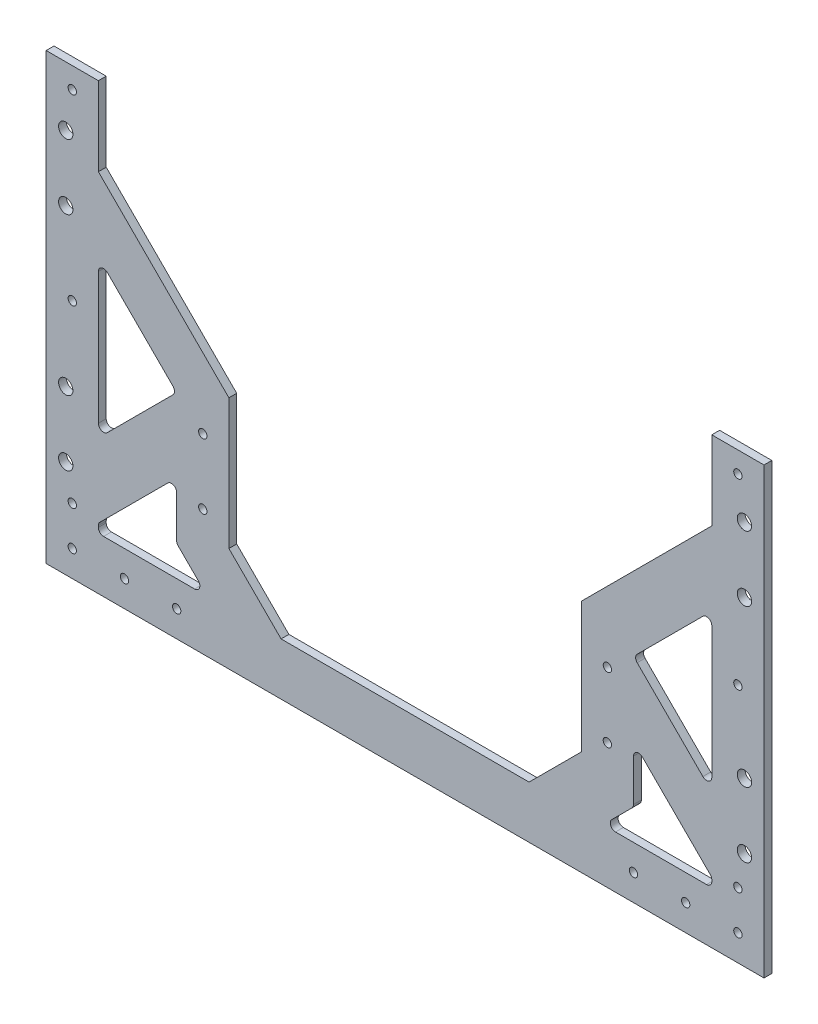
from build123d import *

# Parameters (mm, degrees)
EXTRUDE1_DEPTH     = 3
SKETCH2_R          = 2.75
SKETCH2_R_2        = 1.6
CUT_EXTRUDE1_DEPTH = 3


with BuildPart() as part:
    # Sketch1 → Extrude1 (new body)
    with BuildSketch(Plane.XY):
        Polygon((-21.510078765, 142.709593142), (-21.510078765, -27.502951786), (253.489921235, -27.502951786), (253.489921235, 142.709593142), (233.489921235, 142.709593142), (233.489921235, 112.497048214), (183.489921235, 62.497048214), (183.489921235, 12.497048214), (163.489921235, -7.502951786), (68.489921235, -7.502951786), (48.489921235, 12.497048214), (48.489921235, 62.497048214), (-1.510078765, 112.497048214), (-1.510078765, 142.709593142), align=None)
        with BuildLine():
            Line((-1.510078765, -5.502951786), (-1.510078765, -4.899921406))
            ThreePointArc((-1.510078765, -4.899921406), (-1.35783783, -4.134554541), (-0.924292327, -3.485707844))
            Line((-0.924292327, -3.485707844), (25.075707673, 22.514292156))
            ThreePointArc((25.075707673, 22.514292156), (27.2552881, 22.947837659), (28.489921235, 21.100078594))
            Line((28.489921235, 21.100078594), (28.489921235, 5.041204091))
            ThreePointArc((28.489921235, 5.041204091), (28.64216217, 4.275837226), (29.075707673, 3.626990528))
            Line((29.075707673, 3.626990528), (36.791436425, -4.088738224))
            ThreePointArc((36.791436425, -4.088738224), (37.224981928, -6.268318651), (35.377222863, -7.502951786))
            Line((35.377222863, -7.502951786), (0.489921235, -7.502951786))
            ThreePointArc((0.489921235, -7.502951786), (-0.924292327, -6.917165349), (-1.510078765, -5.502951786))
        make_face(mode=Mode.SUBTRACT)
        with BuildLine():
            Line((1.904134797, 80.798563404), (27.075707673, 55.626990528))
            ThreePointArc((27.075707673, 55.626990528), (27.66149411, 54.212776966), (27.075707673, 52.798563404))
            Line((27.075707673, 52.798563404), (1.904134797, 27.626990528))
            ThreePointArc((1.904134797, 27.626990528), (-0.27544563, 27.193445026), (-1.510078765, 29.041204091))
            Line((-1.510078765, 29.041204091), (-1.510078765, 79.384349841))
            ThreePointArc((-1.510078765, 79.384349841), (-0.27544563, 81.232108906), (1.904134797, 80.798563404))
        make_face(mode=Mode.SUBTRACT)
        with BuildLine():
            Line((233.489921235, 29.041204091), (233.489921235, 79.384349841))
            ThreePointArc((233.489921235, 79.384349841), (232.2552881, 81.232108906), (230.075707673, 80.798563404))
            Line((230.075707673, 80.798563404), (204.904134797, 55.626990528))
            ThreePointArc((204.904134797, 55.626990528), (204.31834836, 54.212776966), (204.904134797, 52.798563404))
            Line((204.904134797, 52.798563404), (230.075707673, 27.626990528))
            ThreePointArc((230.075707673, 27.626990528), (232.2552881, 27.193445026), (233.489921235, 29.041204091))
        make_face(mode=Mode.SUBTRACT)
        with BuildLine():
            Line((232.904134797, -3.485707844), (206.904134797, 22.514292156))
            ThreePointArc((206.904134797, 22.514292156), (204.72455437, 22.947837659), (203.489921235, 21.100078594))
            Line((203.489921235, 21.100078594), (203.489921235, 5.041204091))
            ThreePointArc((203.489921235, 5.041204091), (203.3376803, 4.275837226), (202.904134797, 3.626990528))
            Line((202.904134797, 3.626990528), (195.188406045, -4.088738224))
            ThreePointArc((195.188406045, -4.088738224), (194.754860542, -6.268318651), (196.602619607, -7.502951786))
            Line((196.602619607, -7.502951786), (231.489921235, -7.502951786))
            ThreePointArc((231.489921235, -7.502951786), (232.904134797, -6.917165349), (233.489921235, -5.502951786))
            Line((233.489921235, -5.502951786), (233.489921235, -4.899921406))
            ThreePointArc((233.489921235, -4.899921406), (233.3376803, -4.134554541), (232.904134797, -3.485707844))
        make_face(mode=Mode.SUBTRACT)
    extrude(amount=EXTRUDE1_DEPTH)

    # Sketch2 → Cut-Extrude1 (cut)
    with BuildSketch(Plane.XY.offset(3)):
        with Locations((245.989921235, 9.997448214)):
            Circle(SKETCH2_R)
        with Locations((245.989921235, 34.997448214)):
            Circle(SKETCH2_R)
        with Locations((245.989921235, 94.997448214)):
            Circle(SKETCH2_R)
        with Locations((245.989921235, 119.997448214)):
            Circle(SKETCH2_R)
        with Locations((-14.010076813, 9.997448214)):
            Circle(SKETCH2_R)
        with Locations((-14.010076813, 34.997448214)):
            Circle(SKETCH2_R)
        with Locations((-14.010076813, 94.997448214)):
            Circle(SKETCH2_R)
        with Locations((-14.010076813, 119.997448214)):
            Circle(SKETCH2_R)
        with Locations((-11.510078765, 134.709593142)):
            Circle(SKETCH2_R_2)
        with Locations((-11.510078765, 64.709593142)):
            Circle(SKETCH2_R_2)
        with Locations((-11.510078765, -2.502951786)):
            Circle(SKETCH2_R_2)
        with Locations((-11.510078765, -17.502951786)):
            Circle(SKETCH2_R_2)
        with Locations((8.489921235, -17.502951786)):
            Circle(SKETCH2_R_2)
        with Locations((28.489921235, -17.502951786)):
            Circle(SKETCH2_R_2)
        with Locations((203.489923187, -17.502951786)):
            Circle(SKETCH2_R_2)
        with Locations((223.489923187, -17.502951786)):
            Circle(SKETCH2_R_2)
        with Locations((243.489923187, -17.502951786)):
            Circle(SKETCH2_R_2)
        with Locations((243.489923187, -2.502951786)):
            Circle(SKETCH2_R_2)
        with Locations((243.489923187, 64.709593142)):
            Circle(SKETCH2_R_2)
        with Locations((243.489923187, 134.709593142)):
            Circle(SKETCH2_R_2)
        with Locations((38.489921235, 20.569514271)):
            Circle(SKETCH2_R_2)
        with Locations((38.489921235, 45.569514271)):
            Circle(SKETCH2_R_2)
        with Locations((193.489923187, 45.569514271)):
            Circle(SKETCH2_R_2)
        with Locations((193.489923187, 20.569514271)):
            Circle(SKETCH2_R_2)
    extrude(amount=-CUT_EXTRUDE1_DEPTH, mode=Mode.SUBTRACT)


solid = part.part
